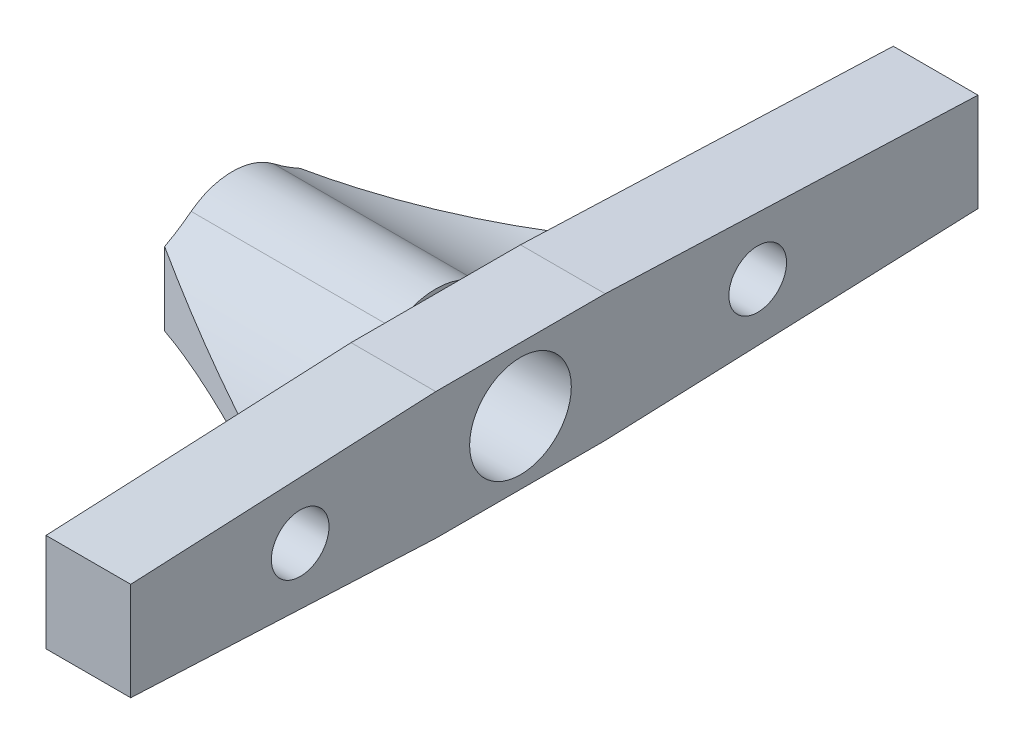
from build123d import *
from build123d.topology import SkipClean

# Parameters (mm, degrees)
SKETCH1_W                = 50
SKETCH1_H                = 7.5
SKETCH1_R                = 3
BOSS_EXTRUDE1_DEPTH      = 5
BOSS_EXTRUDE2_START      = 12
SKETCH2_R                = 4
SKETCH2_R_2              = 3
BOSS_EXTRUDE2_DEPTH      = 12
BOSS_EXTRUDE3_DEPTH      = 0.7
BOSS_EXTRUDE3_DEPTH_BACK = 0.7
CUT_EXTRUDE1_DEPTH       = 2
M3_CLEARANCE_HOLE1_D     = 3.4
M3_CLEARANCE_HOLE1_DEPTH = 12
M3_CLEARANCE_HOLE1_TIP   = 1.021463052
FILLET1_R                = 12
SKETCH10_W               = 58.526718394
SKETCH10_H               = 17.276675166
CUT_EXTRUDE2_DEPTH       = 10


with BuildPart() as part:
    # Sketch1 → Boss-Extrude1 (new body)
    with BuildSketch(Plane(origin=(0, 0, 0), x_dir=(0, 0, -1), z_dir=(1, 0, 0))):
        with Locations((2, 0)):
            Rectangle(SKETCH1_W, SKETCH1_H)
        Circle(SKETCH1_R, mode=Mode.SUBTRACT)
    extrude(amount=BOSS_EXTRUDE1_DEPTH)

    # Sketch2 → Boss-Extrude2 (add)
    with SkipClean():  # the faces are left unmerged after this step: merging them gives an invalid solid
        with BuildSketch(Plane.ZY.offset(BOSS_EXTRUDE2_START)):
            with Locations(Location((0, 0, 0), (0, 0, 249.635865194))):
                Circle(SKETCH2_R)
            Circle(SKETCH2_R_2, mode=Mode.SUBTRACT)
        extrude(amount=-BOSS_EXTRUDE2_DEPTH)

    # Sketch3 → Boss-Extrude3 (add, two sides: drawn at the far end of the back side and taken through both)
    with SkipClean():  # the faces are left unmerged after this step: merging them gives an invalid solid
        with BuildSketch(Plane(origin=(0, 0, 0), x_dir=(1, 0, 0), z_dir=(0, 1, 0)).offset(-BOSS_EXTRUDE3_DEPTH_BACK)):
            Polygon((-12, 4), (0, 11.4), (0, 3.4), (-12, 3.4), align=None)
            Polygon((-12, -3.4), (0, -3.4), (0, -10.4), (-12, -4), align=None)
        extrude(amount=BOSS_EXTRUDE3_DEPTH + BOSS_EXTRUDE3_DEPTH_BACK)

    # Sketch4 → Cut-Extrude1 (cut)
    with SkipClean():  # the faces are left unmerged after this step: merging them gives an invalid solid
        with BuildSketch(Plane.ZY):
            Polygon((-12.556624327, 2.5), (-15.443375673, 2.5), (-16.886751346, 0), (-15.443375673, -2.5), (-12.556624327, -2.5), (-11.113248654, 0), align=None)
            Polygon((14.443375673, 2.5), (11.556624327, 2.5), (10.113248654, 0), (11.556624327, -2.5), (14.443375673, -2.5), (15.886751346, 0), align=None)
        extrude(amount=-CUT_EXTRUDE1_DEPTH, mode=Mode.SUBTRACT)

    # M3 Clearance Hole1
    with Locations(Plane.ZY.offset(-2)):
        with Locations((-14, 0), (13, 0)):
            Hole(M3_CLEARANCE_HOLE1_D / 2, depth=M3_CLEARANCE_HOLE1_DEPTH)
            with Locations((0, 0, -(M3_CLEARANCE_HOLE1_DEPTH + M3_CLEARANCE_HOLE1_TIP / 2))):  # 118° drill point
                Cone(0, M3_CLEARANCE_HOLE1_D / 2, M3_CLEARANCE_HOLE1_TIP, mode=Mode.SUBTRACT)

    # Fillet1
    # the kernel refuses this fillet: 12 mm, written as the material it adds along each edge
    with BuildSketch(Plane(origin=(0, -0.7, 3.938273734), x_dir=(0, -0.8543862513490332, -0.5196384642284927), z_dir=(-1, 0, 0))) as fillet1_piece_1_section:
        with BuildLine():
            CenterArc((7.242040693, 11.185661571), FILLET1_R, 211.308003518, 37.462651073)
            Line((-3.010594323, 4.95), (0, 0))
            ThreePointArc((0, 0), (1.448408139, 0.271446143), (2.896816277, 0))
        make_face()
    fillet1_piece_1 = extrude(amount=12, mode=Mode.PRIVATE)
    fillet1_piece_1 = split(fillet1_piece_1, bisect_by=Plane(origin=(-6.307781997, -1.304831425, 7.035849602), z_dir=(0.4705882352941177, 0, -0.8823529411764706)), keep=Keep.TOP, mode=Mode.PRIVATE)
    add(fillet1_piece_1)
    with BuildSketch(Plane(origin=(0, -0.7, -3.938273734), x_dir=(0, 0, -1), z_dir=(-1, 0, 0))) as fillet1_piece_2_section:
        with BuildLine():
            CenterArc((5.793632555, 12), FILLET1_R, 232.537348927, 37.462651073)
            ThreePointArc((-1.505297161, 2.475), (-0.520728728, 1.378553857), (0, 0))
            Line((0, 0), (5.793632555, 0))
        make_face()
    fillet1_piece_2 = extrude(amount=12, mode=Mode.PRIVATE)
    fillet1_piece_2 = split(fillet1_piece_2, bisect_by=Plane(origin=(-6.659764373, -1.285299154, -7.293145303), z_dir=(0.5248887029964605, 0, 0.85117086972399)), keep=Keep.TOP, mode=Mode.PRIVATE)
    add(fillet1_piece_2)
    with BuildSketch(Plane(origin=(0, 0.7, -3.938273734), x_dir=(0, 0.8543862513490333, 0.5196384642284927), z_dir=(-1, 0, 0))) as fillet1_piece_3_section:
        with BuildLine():
            CenterArc((7.242040693, 11.185661571), FILLET1_R, 211.308003518, 37.462651073)
            Line((-3.010594323, 4.95), (0, 0))
            ThreePointArc((0, 0), (1.448408139, 0.271446143), (2.896816277, 0))
        make_face()
    fillet1_piece_3 = extrude(amount=12, mode=Mode.PRIVATE)
    fillet1_piece_3 = split(fillet1_piece_3, bisect_by=Plane(origin=(-6.659764373, 1.285299154, -7.293145303), z_dir=(0.5248887029964605, 0, 0.85117086972399)), keep=Keep.TOP, mode=Mode.PRIVATE)
    add(fillet1_piece_3)
    with BuildSketch(Plane(origin=(0, 0.7, 3.938273734), x_dir=(0, 0.8543862513490332, -0.5196384642284927), z_dir=(-1, 0, 0))) as fillet1_piece_4_section:
        with BuildLine():
            CenterArc((7.242040693, -11.185661571), FILLET1_R, 111.22934541, 37.462651073)
            Line((-3.010594323, -4.95), (0, 0))
            ThreePointArc((0, 0), (1.448408139, -0.271446143), (2.896816277, 0))
        make_face()
    fillet1_piece_4 = extrude(amount=12, mode=Mode.PRIVATE)
    fillet1_piece_4 = split(fillet1_piece_4, bisect_by=Plane(origin=(-6.307781997, 1.304831425, 7.035849602), z_dir=(0.4705882352941177, 0, -0.8823529411764706)), keep=Keep.TOP, mode=Mode.PRIVATE)
    add(fillet1_piece_4)

    # Sketch10 → Cut-Extrude2 (cut)
    with BuildSketch(Plane(origin=(5, 0, 0), x_dir=(0, 0, -1), z_dir=(1, 0, 0))):
        with Locations((1.162690709, -0.31968068)):
            Rectangle(SKETCH10_W, SKETCH10_H)
        Polygon((-23, 2.9), (-5, 3.75), (-0.481104297, 5.04930998), (5, 3.75), (27, 2.9), (27, -2.9), (5, -3.75), (-0.481104297, -5.04930998), (-5, -3.75), (-23, -2.9), align=None, mode=Mode.SUBTRACT)
    extrude(amount=-CUT_EXTRUDE2_DEPTH, mode=Mode.SUBTRACT)


solid = part.part
